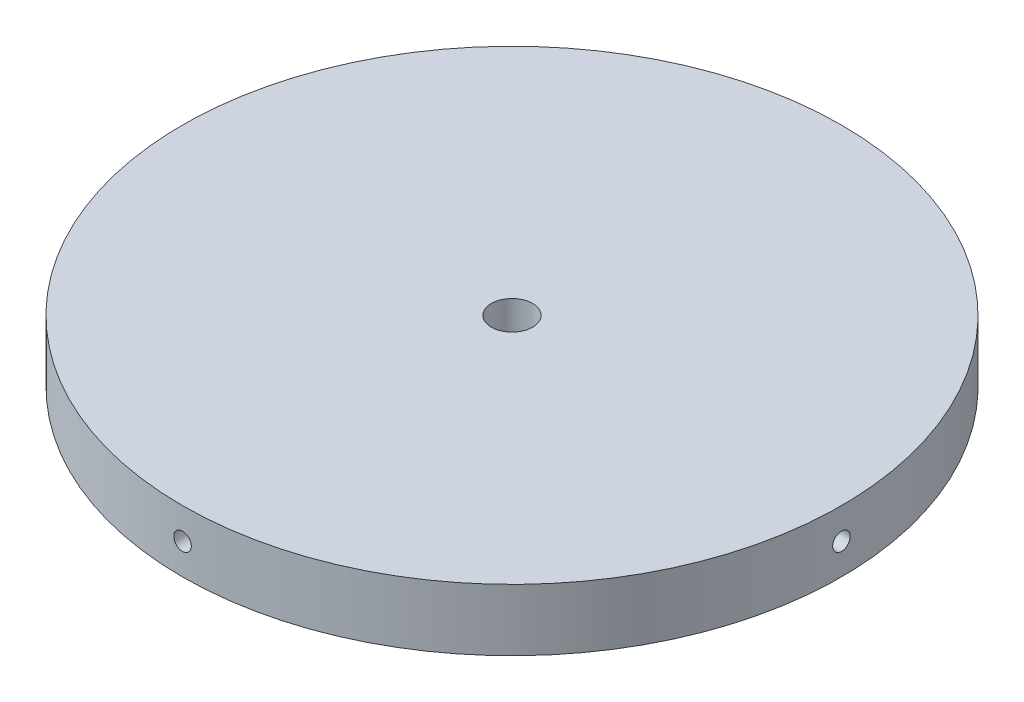
from build123d import *

# Parameters (mm, degrees)
SKETCH1_R           = 50.8
SKETCH1_R_2         = 3.175
BOSS_EXTRUDE1_DEPTH = 4.7625
SKETCH2_R           = 1.35255
CUT_EXTRUDE1_DEPTH  = 12.7
CIRPATTERN1_COUNT   = 4


with BuildPart() as part:
    # Sketch1 → Boss-Extrude1 (new, symmetric)
    with BuildSketch(Plane(origin=(0, 0, 0), x_dir=(1, 0, 0), z_dir=(0, 1, 0))):
        Circle(SKETCH1_R)
        Circle(SKETCH1_R_2, mode=Mode.SUBTRACT)
    extrude(amount=BOSS_EXTRUDE1_DEPTH, both=True)

    # Sketch2 → Cut-Extrude1 (cut)
    with BuildSketch(Plane.XY.offset(50.8)):
        Circle(SKETCH2_R)
    cut_extrude1 = extrude(amount=-CUT_EXTRUDE1_DEPTH, mode=Mode.SUBTRACT)

    # CirPattern1: Cut-Extrude1 ×4 about axis
    cirpattern1_axis = Axis((0, 4.7625, 0), (0, -1, 0))
    for i in range(1, CIRPATTERN1_COUNT):
        add(cut_extrude1.rotate(cirpattern1_axis, i * 360 / CIRPATTERN1_COUNT), mode=Mode.SUBTRACT)


solid = part.part
